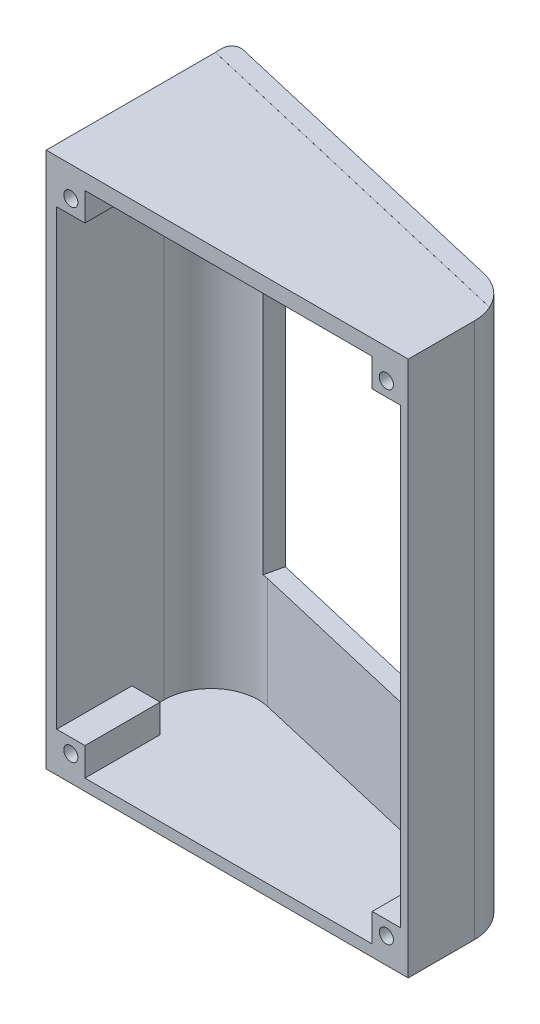
from build123d import *

# Parameters (mm, degrees)
RESSALTO_EXTRUS_O1_DEPTH   = 114
CORTE_EXTRUS_O1_DEPTH      = 59
RESSALTO_EXTRUS_O3_DEPTH   = 4
FILETE1_R                  = 10
FILETE2_R                  = 10
FILETE3_R                  = 10
FILETE4_R                  = 2
CORTE_EXTRUS_O2_DEPTH      = 19
CORTE_EXTRUS_O2_DEPTH_BACK = 10
F_3DSKETCH5_R              = 1.5
RESSALTO_EXTRUS_O6_DEPTH   = 16


with BuildPart() as part:
    # Esboço1 → Ressalto-extrusão1 (new body)
    with BuildSketch(Plane(origin=(0, 0, 0), x_dir=(1, 0, 0), z_dir=(0, 1, 0))):
        Polygon((113.296704203, 18.392857143), (190.296704203, 0.392857143), (190.296704203, -21.607142857), (113.296704203, -21.607142857), align=None)
    extrude(amount=RESSALTO_EXTRUS_O1_DEPTH)

    # 3DSketch1 → Corte-extrusão1 (cut)
    with BuildSketch(Plane(origin=(115.537266243, 110.682804253, 21.607142857), x_dir=(0.5597225204223067, -0.8286800951706879, 0), z_dir=(0, 0, -1))):
        Polygon((0, 0), (40.922432447, -60.586458429), (130.621864407, 0), (89.699431959, 60.586458429), align=None)
    extrude(amount=CORTE_EXTRUS_O1_DEPTH, mode=Mode.SUBTRACT)

    # 3DSketch3 → Ressalto-extrusão3 (add, along a direction that is not the sketch's normal)
    with BuildSketch(Plane(origin=(113.280710176, 114.017648872, -18.396596006), x_dir=(0.5549294721149596, -0.8217207699541985, 0.12972377270219831), z_dir=(-0.22762936703818706, 0, 0.9737478478855778))):
        Polygon((0, 0), (45.064591164, 64.978311237), (138.756352747, 0), (93.691761582, -64.978311237), align=None)
    extrude(amount=RESSALTO_EXTRUS_O3_DEPTH, dir=(0, 0, 1))

    # Filete1
    # the kernel refuses this fillet: 10 mm, written as the material it takes off along each edge
    with BuildSketch(Plane(origin=(190.296704203, -19.829841849, -0.392857143), x_dir=(-0.973747847885578, 0, -0.22762936703818593), z_dir=(0, 1, 0))) as filete1_piece_1:
        with BuildLine():
            CenterArc((FILETE1_R * 0.793193673946, FILETE1_R), FILETE1_R, 193.15754274, 76.84245726)
            Line((-FILETE1_R * 0.180554173939, FILETE1_R * 0.772370632962), (0, 0))
            Line((0, 0), (FILETE1_R * 0.793193673946, 0))
        make_face()
    extrude(amount=153.659683697, mode=Mode.SUBTRACT)

    # Filete2
    filete2_edges = [part.edges().sort_by_distance(p)[0] for p in [
        (188.649265411, 56.560934739, 3.222027295),
    ]]
    fillet(filete2_edges, radius=FILETE2_R)

    # Filete3
    filete3_edges = [part.edges().sort_by_distance(p)[0] for p in [
        (115.537266243, 56.560934739, -13.869089393),
    ]]
    fillet(filete3_edges, radius=FILETE3_R)

    # Filete4
    filete4_edges = [part.edges().sort_by_distance(p)[0] for p in [
        (113.280710176, 57.008160365, -18.396596006),
    ]]
    fillet(filete4_edges, radius=FILETE4_R)

    # 3DSketch4 → Corte-extrusão2 (cut, two sides: drawn at the far end of the back side and taken through both)
    with BuildSketch(Plane(origin=(170.820373008, 88.008160365, -4.945765734), x_dir=(-0.5677884026874886, -0.8124033121057346, -0.13272975647240007), z_dir=(0.22762936703818715, 0, -0.9737478478855778)).offset(-CORTE_EXTRUS_O2_DEPTH_BACK)):
        Polygon((0, 0), (25.94776869, 36.151947389), (76.316774041, 0), (50.369005351, -36.151947389), align=None)
    extrude(amount=CORTE_EXTRUS_O2_DEPTH + CORTE_EXTRUS_O2_DEPTH_BACK, mode=Mode.SUBTRACT)

    # 3DSketch5 → Ressalto-extrusão6 (add)
    # profile 1 of 4: a face of its own
    with BuildSketch(Plane(origin=(115.537266243, 110.682804253, 21.607142857), x_dir=(0.5597225204223067, -0.8286800951706879, 0), z_dir=(0, 0, -1))):
        Polygon((0, 0), (3.358335123, -4.972080571), (8.330415694, -1.613745448), (4.972080571, 3.358335123), align=None)
        with Locations(Location((4.165207847, -0.806872724, 0), (0, 0, 304.036610354))):
            Circle(F_3DSKETCH5_R, mode=Mode.SUBTRACT)
    # profile 2 of 4: a face of its own
    with BuildSketch(Plane(origin=(115.537266243, 110.682804253, 21.607142857), x_dir=(0.5597225204223067, -0.8286800951706879, 0), z_dir=(0, 0, -1))):
        Polygon((40.922432447, -60.586458429), (37.564097325, -55.614377858), (42.536177896, -52.256042735), (45.894513018, -57.228123306), align=None)
        with Locations(Location((41.729305172, -56.421250582, 0), (0, 0, 275.729153182))):
            Circle(F_3DSKETCH5_R, mode=Mode.SUBTRACT)
    # profile 3 of 4: a face of its own
    with BuildSketch(Plane(origin=(115.537266243, 110.682804253, 21.607142857), x_dir=(0.5597225204223067, -0.8286800951706879, 0), z_dir=(0, 0, -1))):
        Polygon((130.621864407, 0), (127.263529284, 4.972080571), (122.291448713, 1.613745448), (125.649783836, -3.358335123), align=None)
        with Locations(Location((126.45665656, 0.806872724, 0), (0, 0, 332.344067525))):
            Circle(F_3DSKETCH5_R, mode=Mode.SUBTRACT)
    # profile 4 of 4: a face of its own
    with BuildSketch(Plane(origin=(115.537266243, 110.682804253, 21.607142857), x_dir=(0.5597225204223067, -0.8286800951706879, 0), z_dir=(0, 0, -1))):
        Polygon((89.699431959, 60.586458429), (93.057767082, 55.614377858), (88.085686511, 52.256042735), (84.727351388, 57.228123306), align=None)
        with Locations(Location((88.892559235, 56.421250582, 0), (0, 0, 304.036610354))):
            Circle(F_3DSKETCH5_R, mode=Mode.SUBTRACT)
    extrude(amount=RESSALTO_EXTRUS_O6_DEPTH)


solid = part.part
